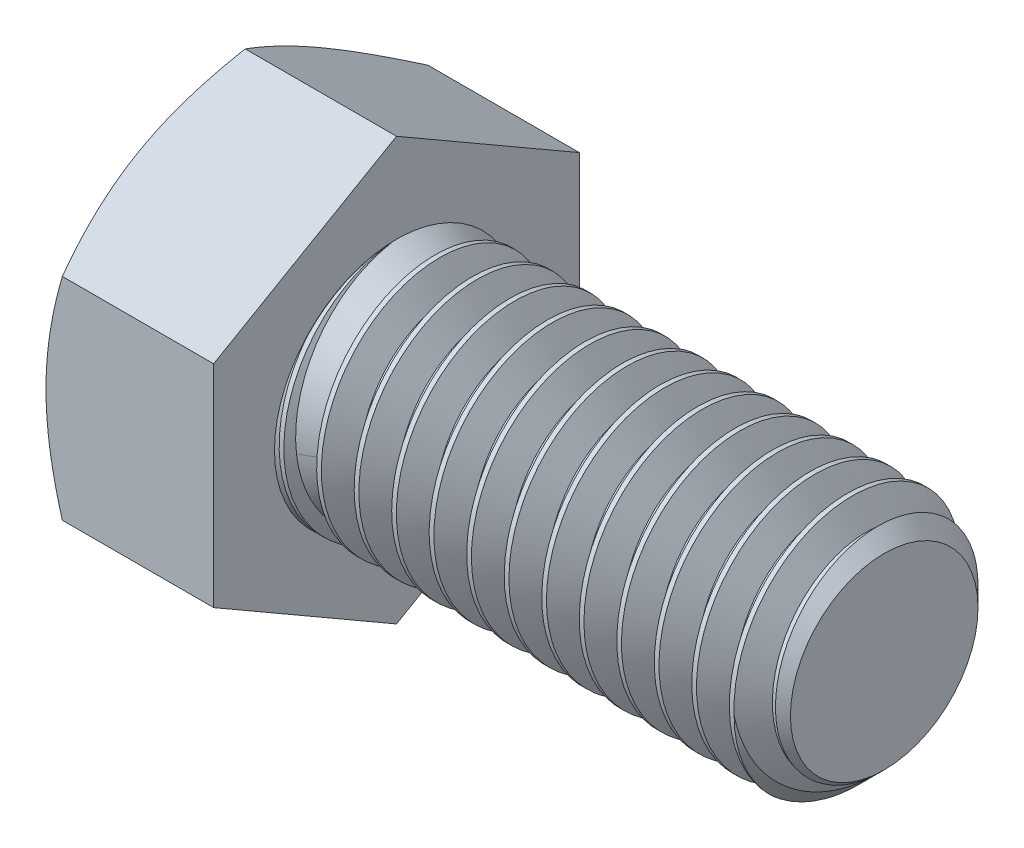
from build123d import *

# Parameters (mm, degrees)
SKETCH5_R           = 6.35
BOSS_EXTRUDE3_DEPTH = 25.4
CHAMFER1_SIZE       = 1.465384615
BOSS_EXTRUDE4_DEPTH = 8.73125
SKETCH8_OUTSIDE_W   = 162.014
SKETCH8_OUTSIDE_H   = 164.962
SKETCH8_OUTSIDE_R   = 9.525
CUT_EXTRUDE3_DEPTH  = 38.103036959
CUT_EXTRUDE3_DRAFT  = -60
CUT_EXTRUDE4_DEPTH  = 0.254
CIRPATTERN1_COUNT   = 6
CUT_SWEEP1_PITCH    = 1.953846154


with BuildPart() as part:
    # Sketch5 → Boss-Extrude3 (new body)
    with BuildSketch(Plane(origin=(17.065625, 0, 0), x_dir=(0, 0, -1), z_dir=(1, 0, 0))):
        Circle(SKETCH5_R)
    extrude(amount=-BOSS_EXTRUDE3_DEPTH)

    # Chamfer1
    chamfer1_edges = [part.edges().sort_by_distance(p)[0] for p in [
        (17.065625, 0, 6.35),
    ]]
    chamfer(chamfer1_edges, length=CHAMFER1_SIZE)

    # Cut-Sweep1: the profile of Sketch10 profile screwed along a right-hand helix of 14 turns, 10 arcs to a turn; built about Z, then put on its axis
    cut_sweep1_z = Axis((0, 0, 0), (0, 0, 1))
    cut_sweep1_corners = [(6.3503, 0, 0.000173205), (5.080939697, 0, -0.732692308), (5.080939697, 0, -0.976923077), (6.3503, 0, -1.70978859)]
    with BuildLine(mode=Mode.PRIVATE) as cut_sweep1_profile:
        Line(cut_sweep1_corners[0], cut_sweep1_corners[1])
        Line(cut_sweep1_corners[1], cut_sweep1_corners[2])
        Line(cut_sweep1_corners[2], cut_sweep1_corners[3])
        Line(cut_sweep1_corners[3], cut_sweep1_corners[0])
    cut_sweep1_cap = Face(cut_sweep1_profile.wire())
    cut_sweep1_turn_angles = [0, 18, 36, 54, 72, 90, 108, 126, 144, 162, 180, 198, 216, 234, 252, 270, 288, 306, 324, 342, 360]
    cut_sweep1_turn_weights = [1, 0.9510565162951535, 1, 0.9510565162951535, 1, 0.9510565162951535, 1, 0.9510565162951535, 1, 0.9510565162951535, 1, 0.9510565162951535, 1, 0.9510565162951535, 1, 0.9510565162951535, 1, 0.9510565162951535, 1, 0.9510565162951535, 1]
    cut_sweep1_turn_rails = [Edge.make_bspline([Vector(p[0], p[1], 0).rotate(cut_sweep1_z, cut_sweep1_turn_angles[k]) / cut_sweep1_turn_weights[k] + Vector(0, 0, p[2] + CUT_SWEEP1_PITCH * cut_sweep1_turn_angles[k] / 360) for k in range(21)], [0, 0, 0, 1, 1, 2, 2, 3, 3, 4, 4, 5, 5, 6, 6, 7, 7, 8, 8, 9, 9, 10, 10, 10], 2, cut_sweep1_turn_weights) for p in cut_sweep1_corners]
    cut_sweep1_turn_sides = [Face.make_surface_from_curves(cut_sweep1_turn_rails[p[0]], cut_sweep1_turn_rails[p[1]]) for p in [(0, 1), (1, 2), (2, 3), (3, 0)]]
    cut_sweep1 = Plane(origin=(17.065625, 0, 0), x_dir=(0, 1, 0), z_dir=(-1, 0, 0)) * Solid(Shell([*[p.moved(Location((0, 0, CUT_SWEEP1_PITCH * i))) for i in range(14) for p in cut_sweep1_turn_sides], cut_sweep1_cap, cut_sweep1_cap.rotate(cut_sweep1_z, 5040).moved(Location((0, 0, CUT_SWEEP1_PITCH * 5040 / 360)))]))
    add(cut_sweep1, mode=Mode.SUBTRACT)



with BuildPart() as body_2:
    # Sketch6 → Boss-Extrude4 (new body)
    with BuildSketch(Plane.ZY.offset(8.334375)):
        Polygon((9.525, 5.499261314), (0, 10.998522628), (-9.525, 5.499261314), (-9.525, -5.499261314), (0, -10.998522628), (9.525, -5.499261314), align=None)
    extrude(amount=BOSS_EXTRUDE4_DEPTH)


with BuildPart() as cut_extrude3_tool:
    # Sketch8 outside → Cut-Extrude3 (with draft: the straight prism first)
    with BuildSketch(Plane.ZY.offset(17.065625)):
        Rectangle(SKETCH8_OUTSIDE_W, SKETCH8_OUTSIDE_H)
        Circle(SKETCH8_OUTSIDE_R, mode=Mode.SUBTRACT)
    extrude(amount=-CUT_EXTRUDE3_DEPTH)
    # Cut-Extrude3: the draft: its side faces are tilted about the plane it starts from
    cut_extrude3_sides = [cut_extrude3_tool.faces().sort_by_distance(p)[0] for p in [
        (1.985893479, -82.481, 0),
        (1.985893479, 0, 81.007),
        (1.985893479, 82.481, 0),
        (1.985893479, 0, -81.007),
        (1.985893479, 0, -9.525),
    ]]
    draft(cut_extrude3_sides, Plane.ZY.offset(17.065625), CUT_EXTRUDE3_DRAFT)


with BuildPart() as body_2_1:
    add(body_2.part)

    # Cut-Extrude3: cut by cut_extrude3_tool
    add(cut_extrude3_tool.part, mode=Mode.SUBTRACT)

    # Sketch12 → Cut-Extrude4 (cut)
    with BuildSketch(Plane.ZY.offset(17.065625)):
        with BuildLine():
            Line((0.28575, 7.33425), (0.28575, 4.09575))
            ThreePointArc((0.28575, 4.09575), (0, 3.81), (-0.28575, 4.09575))
            Line((-0.28575, 4.09575), (-0.28575, 7.33425))
            ThreePointArc((-0.28575, 7.33425), (0, 7.62), (0.28575, 7.33425))
        make_face()
    cut_extrude4 = extrude(amount=-CUT_EXTRUDE4_DEPTH, mode=Mode.SUBTRACT)

    # CirPattern1: Cut-Extrude4 ×6 about axis
    cirpattern1_axis = Axis((0, 0, 0), (1, 0, 0))
    for i in range(1, CIRPATTERN1_COUNT):
        add(cut_extrude4.rotate(cirpattern1_axis, i * 360 / CIRPATTERN1_COUNT), mode=Mode.SUBTRACT)


with BuildPart() as part_1:
    add(part.part)

    add(body_2_1.part)  # Revolve7 merges body 2
    # Sketch13 → Revolve7 (revolve)
    with BuildSketch(Plane.XY, mode=Mode.PRIVATE) as revolve7_sk:
        Polygon((-8.588375, 0), (2.67492618, 0), (-8.334375, 6.356223), (-8.588375, 6.356223), align=None)
    revolve(revolve7_sk.sketch.rotate(Axis((-8.588375, 0, 0), (1, 0, 0)), 90), axis=Axis((-8.588375, 0, 0), (1, 0, 0)))


solid = part_1.part
